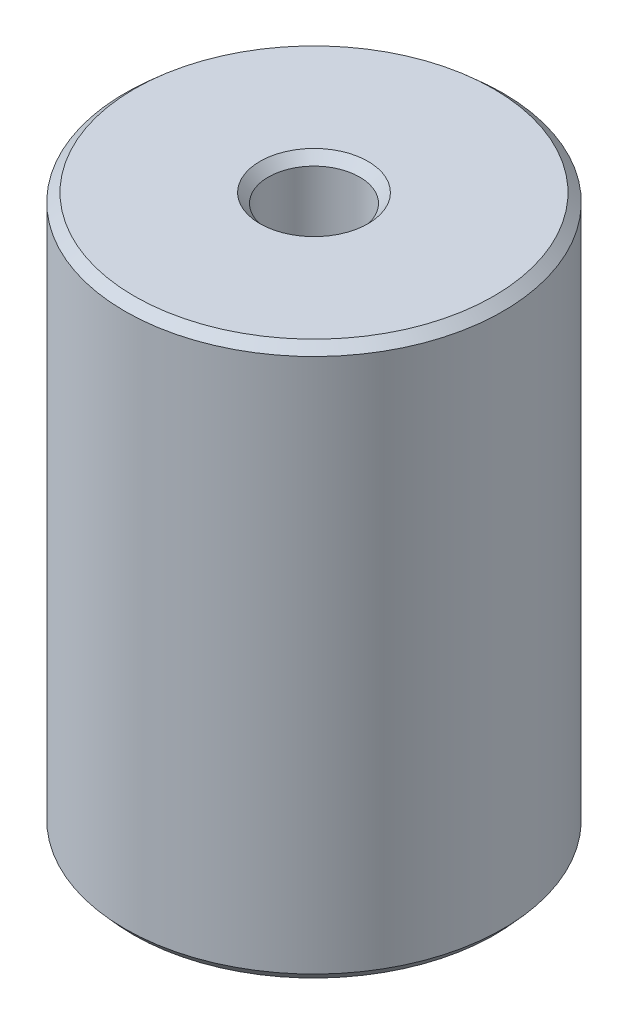
from build123d import *
from OCP.BRepFilletAPI import BRepFilletAPI_MakeChamfer

# Parameters (mm, degrees)
SKETCH1_R           = 5
BOSS_EXTRUDE1_DEPTH = 14.618838002
SKETCH2_R           = 1.207690693
CUT_EXTRUDE1_DEPTH  = 17.239163295
CHAMFER1_SIZE       = 0.222122847
CHAMFER1_SIZE2      = 0.248153868


with BuildPart() as part:
    # Sketch1 → Boss-Extrude1 (new body)
    with BuildSketch(Plane(origin=(0, 0, 0), x_dir=(1, 0, 0), z_dir=(0, 1, 0))):
        Circle(SKETCH1_R)
    extrude(amount=BOSS_EXTRUDE1_DEPTH)

    # Sketch2 → Cut-Extrude1 (cut, through all)
    with BuildSketch(Plane(origin=(0, 0, 0), x_dir=(1, 0, 0), z_dir=(0, 1, 0))):
        Circle(SKETCH2_R)
    extrude(amount=CUT_EXTRUDE1_DEPTH, mode=Mode.SUBTRACT)

    # Chamfer1: one chamfer whose edges measure the first distance from different faces: ONE call of the kernel's chamfer builder (chamfer() names one face for all edges)
    chamfer1_edges_1 = [part.edges().sort_by_distance(p)[0] for p in [
        (-1.207690693, 14.618838002, 0),
    ]]
    chamfer1_side_1 = [part.faces().sort_by_distance(p)[0] for p in [
        (-4.858578644, 14.618838002, 0),
    ]]
    chamfer1_edges_2 = [part.edges().sort_by_distance(p)[0] for p in [
        (-1.207690693, 0, 0),
    ]]
    chamfer1_side_2 = [part.faces().sort_by_distance(p)[0] for p in [
        (-1.207690693, 7.309419001, 0),
    ]]
    chamfer1_edges_3 = [part.edges().sort_by_distance(p)[0] for p in [
        (-5, 0, 0),
    ]]
    chamfer1_side_3 = [part.faces().sort_by_distance(p)[0] for p in [
        (-4.858578644, 0, 0),
    ]]
    chamfer1_edges_4 = [part.edges().sort_by_distance(p)[0] for p in [
        (-5, 14.618838002, 0),
    ]]
    chamfer1_side_4 = [part.faces().sort_by_distance(p)[0] for p in [
        (-5, 7.309419001, 0),
    ]]
    chamfer1 = BRepFilletAPI_MakeChamfer(part.part.solid().wrapped)
    for e in chamfer1_edges_1:
        chamfer1.Add(CHAMFER1_SIZE, CHAMFER1_SIZE2, e.wrapped, chamfer1_side_1[0].wrapped)  # the first distance lies on this face
    for e in chamfer1_edges_2:
        chamfer1.Add(CHAMFER1_SIZE, CHAMFER1_SIZE2, e.wrapped, chamfer1_side_2[0].wrapped)  # the first distance lies on this face
    for e in chamfer1_edges_3:
        chamfer1.Add(CHAMFER1_SIZE, CHAMFER1_SIZE2, e.wrapped, chamfer1_side_3[0].wrapped)  # the first distance lies on this face
    for e in chamfer1_edges_4:
        chamfer1.Add(CHAMFER1_SIZE, CHAMFER1_SIZE2, e.wrapped, chamfer1_side_4[0].wrapped)  # the first distance lies on this face
    add(Compound.cast(chamfer1.Shape()), mode=Mode.REPLACE)


solid = part.part
